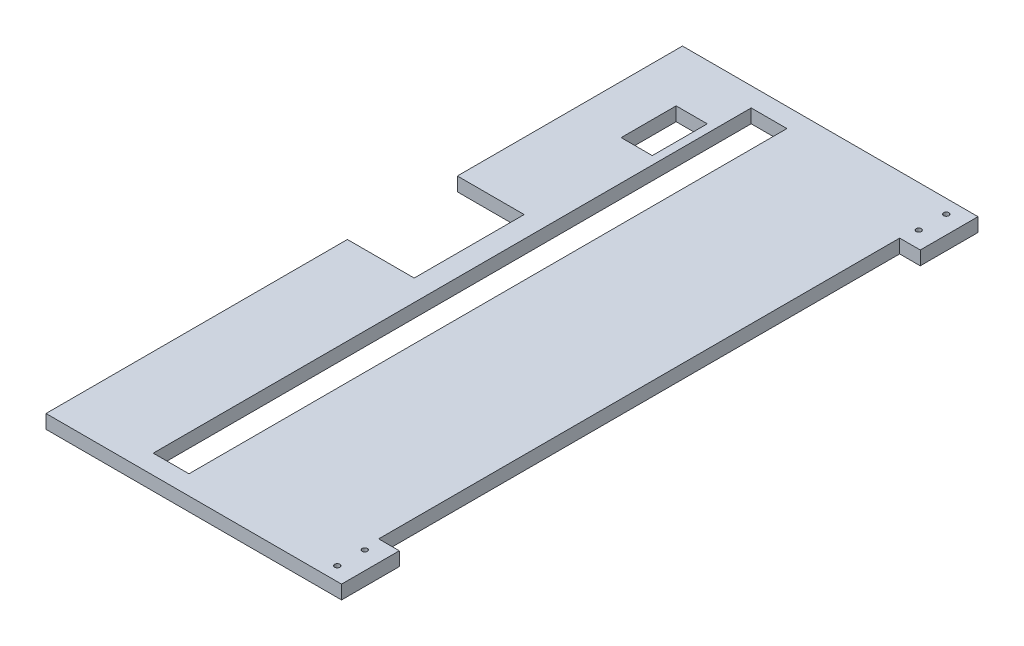
from build123d import *

# Parameters (mm, degrees)
SKETCH1_W           = 430
SKETCH1_H           = 463
BOSS_EXTRUDE1_DEPTH = 10
SKETCH2_W           = 48.6
SKETCH2_H           = 80
CUT_EXTRUDE1_DEPTH  = 10
SKETCH3_R           = 1.9
SKETCH3_W           = 26
SKETCH3_H           = 435
SKETCH3_W_2         = 22.64710068
SKETCH3_H_2         = 40
SKETCH3_W_3         = 30
SKETCH3_H_3         = 379
CUT_EXTRUDE2_DEPTH  = 10
SKETCH4_W           = 65
SKETCH4_H           = 65
CUT_EXTRUDE3_DEPTH  = 10
SKETCH5_W           = 636.219925535
SKETCH5_H           = 371.910781629
CUT_EXTRUDE5_DEPTH  = 255


with BuildPart() as part:
    # Sketch1 → Boss-Extrude1 (new body)
    with BuildSketch(Plane(origin=(0, 0, 0), x_dir=(1, 0, 0), z_dir=(0, 1, 0))):
        with Locations((6126.084066999, -8720.812377786)):
            Rectangle(SKETCH1_W, SKETCH1_H)
    extrude(amount=BOSS_EXTRUDE1_DEPTH)

    # Sketch2 → Cut-Extrude1 (cut)
    with BuildSketch(Plane(origin=(0, 10, 0), x_dir=(1, 0, 0), z_dir=(0, 1, 0))):
        with Locations((5935.384066999, -8693.059787309)):
            Rectangle(SKETCH2_W, SKETCH2_H)
        with Locations((6316.784066999, -8693.384418705)):
            Rectangle(SKETCH2_W, SKETCH2_H)
    extrude(amount=-CUT_EXTRUDE1_DEPTH, mode=Mode.SUBTRACT)

    # Sketch3 → Cut-Extrude2 (cut)
    with BuildSketch(Plane(origin=(0, 10, 0), x_dir=(1, 0, 0), z_dir=(0, 1, 0))):
        with Locations((6112.984066999, -8942.312377786)):
            Circle(SKETCH3_R)
        with Locations((6139.184066999, -8942.312377786)):
            Circle(SKETCH3_R)
        with Locations((6112.984066999, -8499.312377786)):
            Circle(SKETCH3_R)
        with Locations((6139.184066999, -8499.312377786)):
            Circle(SKETCH3_R)
        with Locations((6112.984066999, -8922.312377786)):
            Circle(SKETCH3_R)
        with Locations((6139.184066999, -8922.312377786)):
            Circle(SKETCH3_R)
        with Locations((6112.984066999, -8519.312377786)):
            Circle(SKETCH3_R)
        with Locations((6139.184066999, -8519.312377786)):
            Circle(SKETCH3_R)
        Polygon((5975.084066999, -8541.651929061), (5975.084066999, -8938.312377786), (6001.084066999, -8938.312377786), (6001.084066999, -8503.312377786), (5975.084066999, -8503.312377786), align=None)
        with Locations((6264.084066999, -8720.812377786)):
            Rectangle(SKETCH3_W, SKETCH3_H)
        with Locations((5957.807617339, -8549.312377786)):
            Rectangle(SKETCH3_W_2, SKETCH3_H_2)
        with Locations((6126.084066999, -8720.812377786)):
            Rectangle(SKETCH3_W_3, SKETCH3_H_3)
    extrude(amount=-CUT_EXTRUDE2_DEPTH, mode=Mode.SUBTRACT)

    # Sketch4 → Cut-Extrude3 (cut)
    with BuildSketch(Plane(origin=(0, 10, 0), x_dir=(1, 0, 0), z_dir=(0, 1, 0))):
        with Locations((6218.584066999, -8865.596518708)):
            Rectangle(SKETCH4_W, SKETCH4_H)
    extrude(amount=-CUT_EXTRUDE3_DEPTH, mode=Mode.SUBTRACT)

    # Sketch5 → Cut-Extrude5 (cut)
    with BuildSketch(Plane.ZY.offset(-6126.084067)):
        with Locations((8713.796116909, -43.108967652)):
            Rectangle(SKETCH5_W, SKETCH5_H)
    extrude(amount=-CUT_EXTRUDE5_DEPTH, mode=Mode.SUBTRACT)


solid = part.part
